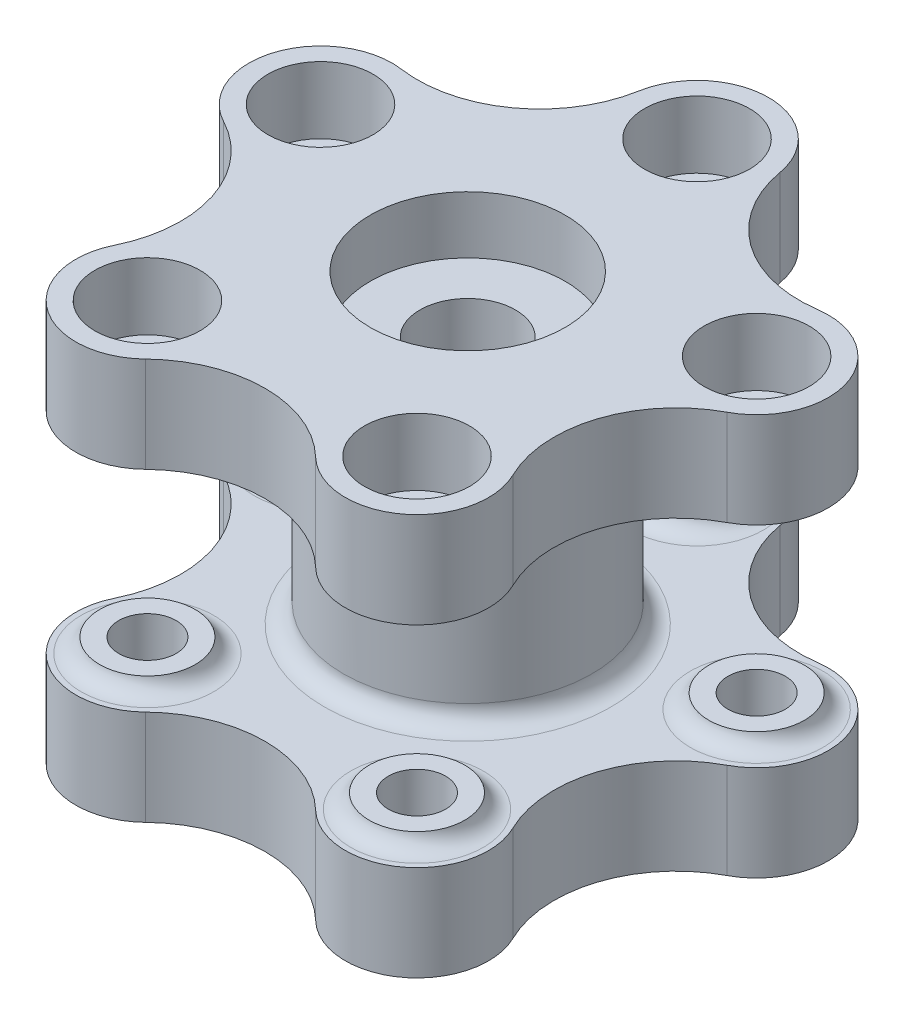
from build123d import *

# Parameters (mm, degrees)
SKETCH1_R           = 1.5
BOSS_EXTRUDE1_DEPTH = 5
SKETCH2_R           = 6.5
BOSS_EXTRUDE2_DEPTH = 11
SKETCH3_R           = 1.5
BOSS_EXTRUDE3_DEPTH = 5
SKETCH4_R           = 1.4
CUT_EXTRUDE1_DEPTH  = 31.314506594
FILLET1_R           = 1
CUT_EXTRUDE2_DEPTH  = 3
SKETCH8_R           = 2.5
SKETCH8_R_2         = 1.5
BOSS_EXTRUDE5_DEPTH = 0.75
FILLET4_R           = 1
BOSS_EXTRUDE6_START = 0.75
SKETCH9_R           = 2.5
SKETCH9_R_2         = 1.5
BOSS_EXTRUDE6_DEPTH = 0.75
FILLET5_R           = 1
SKETCH12_R          = 2.75
CUT_EXTRUDE5_DEPTH  = 3.5
SKETCH10_R          = 5.1
CUT_EXTRUDE3_DEPTH  = 3
CUT_EXTRUDE4_START  = -3.5
SKETCH11_R          = 5.1
CUT_EXTRUDE4_DEPTH  = 3.5


with BuildPart() as part:
    # Sketch1 → Boss-Extrude1 (new body)
    with BuildSketch(Plane(origin=(0, 0, 0), x_dir=(1, 0, 0), z_dir=(0, 1, 0))):
        with BuildLine():
            ThreePointArc((-10.887667616, 7.421270575), (-6.233461404, 8.579623579), (-3.693573417, 12.648085961))
            ThreePointArc((-3.693573417, 12.648085961), (0, 15.75), (3.693573417, 12.648085961))
            ThreePointArc((3.693573417, 12.648085961), (6.233461404, 8.579623579), (10.887667616, 7.421270575))
            ThreePointArc((10.887667616, 7.421270575), (14.979140132, 4.867017661), (13.170421528, 0.395676441))
            ThreePointArc((13.170421528, 0.395676441), (10.08595242, -3.277124596), (10.422522062, -8.061488506))
            ThreePointArc((10.422522062, -8.061488506), (9.257617724, -12.742017661), (4.446194733, -12.403544471))
            ThreePointArc((4.446194733, -12.403544471), (0, -10.604997965), (-4.446194733, -12.403544471))
            ThreePointArc((-4.446194733, -12.403544471), (-9.257617724, -12.742017661), (-10.422522062, -8.061488506))
            ThreePointArc((-10.422522062, -8.061488506), (-10.08595242, -3.277124596), (-13.170421528, 0.395676441))
            ThreePointArc((-13.170421528, 0.395676441), (-14.889028798, 2.301972625), (-14.979140132, 4.867017661))
            ThreePointArc((-14.979140132, 4.867017661), (-13.398542888, 6.889216574), (-10.887667616, 7.421270575))
        make_face()
        with Locations(Location((0, 12, 0), (0, 0, 270))):
            Circle(SKETCH1_R, mode=Mode.SUBTRACT)
        with Locations(Location((11.412678196, 3.708203932, 0), (0, 0, 270))):
            Circle(SKETCH1_R, mode=Mode.SUBTRACT)
        with Locations(Location((7.053423028, -9.708203932, 0), (0, 0, 270))):
            Circle(SKETCH1_R, mode=Mode.SUBTRACT)
        with Locations(Location((-7.053423028, -9.708203932, 0), (0, 0, 270))):
            Circle(SKETCH1_R, mode=Mode.SUBTRACT)
        with Locations(Location((-11.412678196, 3.708203932, 0), (0, 0, 270))):
            Circle(SKETCH1_R, mode=Mode.SUBTRACT)
        with BuildLine():
            Line((-1.430908802, -2.05), (1.430908802, -2.05))
            ThreePointArc((1.430908802, -2.05), (0, 2.5), (-1.430908802, -2.05))
        make_face(mode=Mode.SUBTRACT)
    extrude(amount=BOSS_EXTRUDE1_DEPTH)

    # Sketch2 → Boss-Extrude2 (add)
    with BuildSketch(Plane(origin=(0, 5, 0), x_dir=(1, 0, 0), z_dir=(0, 1, 0))):
        with Locations(Location((0, 0, 0), (0, 0, 270))):
            Circle(SKETCH2_R)
        with BuildLine():
            Line((-1.430908802, -2.05), (1.430908802, -2.05))
            ThreePointArc((1.430908802, -2.05), (0, 2.5), (-1.430908802, -2.05))
        make_face(mode=Mode.SUBTRACT)
    extrude(amount=BOSS_EXTRUDE2_DEPTH)

    # Sketch3 → Boss-Extrude3 (add)
    with BuildSketch(Plane(origin=(0, 16, 0), x_dir=(1, 0, 0), z_dir=(0, 1, 0))):
        with BuildLine():
            ThreePointArc((3.693573417, 12.648085961), (0, 15.75), (-3.693573417, 12.648085961))
            ThreePointArc((-3.693573417, 12.648085961), (-6.233461404, 8.579623579), (-10.887667616, 7.421270575))
            ThreePointArc((-10.887667616, 7.421270575), (-14.979140132, 4.867017661), (-13.170421528, 0.395676441))
            ThreePointArc((-13.170421528, 0.395676441), (-10.08595242, -3.277124596), (-10.422522062, -8.061488506))
            ThreePointArc((-10.422522062, -8.061488506), (-9.257617724, -12.742017661), (-4.446194733, -12.403544471))
            ThreePointArc((-4.446194733, -12.403544471), (0, -10.604997965), (4.446194733, -12.403544471))
            ThreePointArc((4.446194733, -12.403544471), (9.257617724, -12.742017661), (10.422522062, -8.061488506))
            ThreePointArc((10.422522062, -8.061488506), (10.08595242, -3.277124596), (13.170421528, 0.395676441))
            ThreePointArc((13.170421528, 0.395676441), (14.979140132, 4.867017661), (10.887667616, 7.421270575))
            ThreePointArc((10.887667616, 7.421270575), (6.233461404, 8.579623579), (3.693573417, 12.648085961))
        make_face()
        with Locations(Location((-7.053423028, -9.708203932, 0), (0, 0, 270))):
            Circle(SKETCH3_R, mode=Mode.SUBTRACT)
        with Locations(Location((7.053423028, -9.708203932, 0), (0, 0, 270))):
            Circle(SKETCH3_R, mode=Mode.SUBTRACT)
        with Locations(Location((11.412678196, 3.708203932, 0), (0, 0, 270))):
            Circle(SKETCH3_R, mode=Mode.SUBTRACT)
        with Locations(Location((-11.412678196, 3.708203932, 0), (0, 0, 270))):
            Circle(SKETCH3_R, mode=Mode.SUBTRACT)
        with Locations(Location((0, 12, 0), (0, 0, 270))):
            Circle(SKETCH3_R, mode=Mode.SUBTRACT)
        with BuildLine():
            Line((-1.430908802, -2.05), (1.430908802, -2.05))
            ThreePointArc((1.430908802, -2.05), (0, 2.5), (-1.430908802, -2.05))
        make_face(mode=Mode.SUBTRACT)
    extrude(amount=BOSS_EXTRUDE3_DEPTH)

    # Sketch4 → Cut-Extrude1 (cut, through all)
    with BuildSketch(Plane.XY):
        with Locations(Location((0, 10.5, 0), (0, 0, 180))):
            Circle(SKETCH4_R)
    extrude(amount=CUT_EXTRUDE1_DEPTH, mode=Mode.SUBTRACT)

    # Fillet1
    fillet1_edges = [part.edges().sort_by_distance(p)[0] for p in [
        (0, 16, -6.5),
        (0, 5, -6.5),
    ]]
    fillet(fillet1_edges, radius=FILLET1_R)

    # Sketch6 → Cut-Extrude2 (cut)
    with BuildSketch(Plane.XZ):
        Polygon((-12.072886484, -6.814239726), (-9.052876438, -5.832978979), (-8.392668149, -2.726943186), (-10.752469907, -0.602168139), (-13.772479953, -1.583428886), (-14.432688242, -4.689464679), align=None)
        Polygon((2.75, -13.58771324), (2.75, -10.41228676), (0, -8.824573519), (-2.75, -10.41228676), (-2.75, -13.58771324), (0, -15.175426481), align=None)
        Polygon((-10.21145419, 9.376281482), (-8.344985335, 6.807307495), (-5.186954173, 7.139229945), (-3.895391865, 10.040126383), (-5.76186072, 12.60910037), (-8.919891883, 12.27717792), align=None)
        Polygon((5.76186072, 12.60910037), (3.895391865, 10.040126383), (5.186954173, 7.139229945), (8.344985335, 6.807307495), (10.21145419, 9.376281482), (8.919891883, 12.27717792), align=None)
        Polygon((13.772479953, -1.583428886), (10.752469907, -0.602168139), (8.392668149, -2.726943186), (9.052876438, -5.832978979), (12.072886484, -6.814239726), (14.432688242, -4.689464679), align=None)
    extrude(amount=-CUT_EXTRUDE2_DEPTH, mode=Mode.SUBTRACT)

    # Sketch8 → Boss-Extrude5 (add)
    # profile 1 of 5: a face of its own
    with BuildSketch(Plane(origin=(0, 5, 0), x_dir=(1, 0, 0), z_dir=(0, 1, 0))):
        with Locations(Location((-7.053423028, -9.708203932, 0), (0, 0, 270))):
            Circle(SKETCH8_R)
        with Locations(Location((-7.053423028, -9.708203932, 0), (0, 0, 90))):
            Circle(SKETCH8_R_2, mode=Mode.SUBTRACT)
    # profile 2 of 5: a face of its own
    with BuildSketch(Plane(origin=(0, 5, 0), x_dir=(1, 0, 0), z_dir=(0, 1, 0))):
        with Locations(Location((-11.412678196, 3.708203932, 0), (0, 0, 270))):
            Circle(SKETCH8_R)
        with Locations(Location((-11.412678196, 3.708203932, 0), (0, 0, 90))):
            Circle(SKETCH8_R_2, mode=Mode.SUBTRACT)
    # profile 3 of 5: a face of its own
    with BuildSketch(Plane(origin=(0, 5, 0), x_dir=(1, 0, 0), z_dir=(0, 1, 0))):
        with Locations(Location((0, 12, 0), (0, 0, 270))):
            Circle(SKETCH8_R)
        with Locations(Location((0, 12, 0), (0, 0, 90))):
            Circle(SKETCH8_R_2, mode=Mode.SUBTRACT)
    # profile 4 of 5: a face of its own
    with BuildSketch(Plane(origin=(0, 5, 0), x_dir=(1, 0, 0), z_dir=(0, 1, 0))):
        with Locations(Location((11.412678196, 3.708203932, 0), (0, 0, 270))):
            Circle(SKETCH8_R)
        with Locations(Location((11.412678196, 3.708203932, 0), (0, 0, 90))):
            Circle(SKETCH8_R_2, mode=Mode.SUBTRACT)
    # profile 5 of 5: a face of its own
    with BuildSketch(Plane(origin=(0, 5, 0), x_dir=(1, 0, 0), z_dir=(0, 1, 0))):
        with Locations(Location((7.053423028, -9.708203932, 0), (0, 0, 270))):
            Circle(SKETCH8_R)
        with Locations(Location((7.053423028, -9.708203932, 0), (0, 0, 90))):
            Circle(SKETCH8_R_2, mode=Mode.SUBTRACT)
    extrude(amount=BOSS_EXTRUDE5_DEPTH)

    # Fillet4
    # the kernel refuses this fillet: 1 mm, written as the material it adds along each edge
    with BuildSketch(Plane(origin=(-7.053423028, 5, 9.708203932), x_dir=(0, 0, 1), z_dir=(-1, 0, 0))) as fillet4_piece_1:
        with BuildLine():
            CenterArc((3.468245837, 1), FILLET4_R, 194.477512186, 75.522487814)
            Line((2.5, 0.75), (2.480635083, 0.745))
            ThreePointArc((2.480635083, 0.745), (2.48, 0.375), (2.48, 0))
            Line((2.48, 0), (2.5, -0.02))
            Line((2.5, -0.02), (3.468245837, -0.02))
            Line((3.468245837, -0.02), (3.468245837, 0))
        make_face()
    revolve(axis=Axis((-7.053423028, 5, 9.708203932), (0, 1, 0)))
    with BuildSketch(Plane(origin=(-11.412678196, 5, -3.708203932), x_dir=(0, 0, 1), z_dir=(-1, 0, 0))) as fillet4_piece_2:
        with BuildLine():
            CenterArc((3.468245837, 1), FILLET4_R, 194.477512186, 75.522487814)
            Line((2.5, 0.75), (2.480635083, 0.745))
            ThreePointArc((2.480635083, 0.745), (2.48, 0.375), (2.48, 0))
            Line((2.48, 0), (2.5, -0.02))
            Line((2.5, -0.02), (3.468245837, -0.02))
            Line((3.468245837, -0.02), (3.468245837, 0))
        make_face()
    revolve(axis=Axis((-11.412678196, 5, -3.708203932), (0, 1, 0)))
    with BuildSketch(Plane(origin=(0, 5, -12), x_dir=(0, 0, 1), z_dir=(-1, 0, 0))) as fillet4_piece_3:
        with BuildLine():
            CenterArc((3.468245837, 1), FILLET4_R, 194.477512186, 75.522487814)
            Line((2.5, 0.75), (2.480635083, 0.745))
            ThreePointArc((2.480635083, 0.745), (2.48, 0.375), (2.48, 0))
            Line((2.48, 0), (2.5, -0.02))
            Line((2.5, -0.02), (3.468245837, -0.02))
            Line((3.468245837, -0.02), (3.468245837, 0))
        make_face()
    revolve(axis=Axis((0, 5, -12), (0, 1, 0)))
    with BuildSketch(Plane(origin=(11.412678196, 5, -3.708203932), x_dir=(0, 0, 1), z_dir=(-1, 0, 0))) as fillet4_piece_4:
        with BuildLine():
            CenterArc((3.468245837, 1), FILLET4_R, 194.477512186, 75.522487814)
            Line((2.5, 0.75), (2.480635083, 0.745))
            ThreePointArc((2.480635083, 0.745), (2.48, 0.375), (2.48, 0))
            Line((2.48, 0), (2.5, -0.02))
            Line((2.5, -0.02), (3.468245837, -0.02))
            Line((3.468245837, -0.02), (3.468245837, 0))
        make_face()
    revolve(axis=Axis((11.412678196, 5, -3.708203932), (0, 1, 0)))
    with BuildSketch(Plane(origin=(7.053423028, 5, 9.708203932), x_dir=(0, 0, 1), z_dir=(-1, 0, 0))) as fillet4_piece_5:
        with BuildLine():
            CenterArc((3.468245837, 1), FILLET4_R, 194.477512186, 75.522487814)
            Line((2.5, 0.75), (2.480635083, 0.745))
            ThreePointArc((2.480635083, 0.745), (2.48, 0.375), (2.48, 0))
            Line((2.48, 0), (2.5, -0.02))
            Line((2.5, -0.02), (3.468245837, -0.02))
            Line((3.468245837, -0.02), (3.468245837, 0))
        make_face()
    revolve(axis=Axis((7.053423028, 5, 9.708203932), (0, 1, 0)))

    # Sketch9 → Boss-Extrude6 (add)
    # profile 1 of 5: a face of its own
    with BuildSketch(Plane.XZ.offset(-16).offset(BOSS_EXTRUDE6_START)):
        with Locations(Location((0, -12, 0), (0, 0, 90))):
            Circle(SKETCH9_R)
        with Locations(Location((0, -12, 0), (0, 0, 270))):
            Circle(SKETCH9_R_2, mode=Mode.SUBTRACT)
    # profile 2 of 5: a face of its own
    with BuildSketch(Plane.XZ.offset(-16).offset(BOSS_EXTRUDE6_START)):
        with Locations(Location((-11.412678196, -3.708203932, 0), (0, 0, 90))):
            Circle(SKETCH9_R)
        with Locations(Location((-11.412678196, -3.708203932, 0), (0, 0, 270))):
            Circle(SKETCH9_R_2, mode=Mode.SUBTRACT)
    # profile 3 of 5: a face of its own
    with BuildSketch(Plane.XZ.offset(-16).offset(BOSS_EXTRUDE6_START)):
        with Locations(Location((-7.053423028, 9.708203932, 0), (0, 0, 90))):
            Circle(SKETCH9_R)
        with Locations(Location((-7.053423028, 9.708203932, 0), (0, 0, 270))):
            Circle(SKETCH9_R_2, mode=Mode.SUBTRACT)
    # profile 4 of 5: a face of its own
    with BuildSketch(Plane.XZ.offset(-16).offset(BOSS_EXTRUDE6_START)):
        with Locations(Location((7.053423028, 9.708203932, 0), (0, 0, 90))):
            Circle(SKETCH9_R)
        with Locations(Location((7.053423028, 9.708203932, 0), (0, 0, 270))):
            Circle(SKETCH9_R_2, mode=Mode.SUBTRACT)
    # profile 5 of 5: a face of its own
    with BuildSketch(Plane.XZ.offset(-16).offset(BOSS_EXTRUDE6_START)):
        with Locations(Location((11.412678196, -3.708203932, 0), (0, 0, 90))):
            Circle(SKETCH9_R)
        with Locations(Location((11.412678196, -3.708203932, 0), (0, 0, 270))):
            Circle(SKETCH9_R_2, mode=Mode.SUBTRACT)
    extrude(amount=-BOSS_EXTRUDE6_DEPTH)

    # Fillet5
    # the kernel refuses this fillet: 1 mm, written as the material it adds along each edge
    with BuildSketch(Plane(origin=(0, 16, -12), x_dir=(0, 0, 1), z_dir=(1, 0, 0))) as fillet5_piece_1:
        with BuildLine():
            CenterArc((3.468245837, 1), FILLET5_R, 194.477512186, 75.522487814)
            Line((2.5, 0.75), (2.480635083, 0.745))
            ThreePointArc((2.480635083, 0.745), (2.48, 0.375), (2.48, 0))
            Line((2.48, 0), (2.5, -0.02))
            Line((2.5, -0.02), (3.468245837, -0.02))
            Line((3.468245837, -0.02), (3.468245837, 0))
        make_face()
    revolve(axis=Axis((0, 16, -12), (0, -1, 0)))
    with BuildSketch(Plane(origin=(-11.412678196, 16, -3.708203932), x_dir=(0, 0, 1), z_dir=(1, 0, 0))) as fillet5_piece_2:
        with BuildLine():
            CenterArc((3.468245837, 1), FILLET5_R, 194.477512186, 75.522487814)
            Line((2.5, 0.75), (2.480635083, 0.745))
            ThreePointArc((2.480635083, 0.745), (2.48, 0.375), (2.48, 0))
            Line((2.48, 0), (2.5, -0.02))
            Line((2.5, -0.02), (3.468245837, -0.02))
            Line((3.468245837, -0.02), (3.468245837, 0))
        make_face()
    revolve(axis=Axis((-11.412678196, 16, -3.708203932), (0, -1, 0)))
    with BuildSketch(Plane(origin=(-7.053423028, 16, 9.708203932), x_dir=(0, 0, 1), z_dir=(1, 0, 0))) as fillet5_piece_3:
        with BuildLine():
            CenterArc((3.468245837, 1), FILLET5_R, 194.477512186, 75.522487814)
            Line((2.5, 0.75), (2.480635083, 0.745))
            ThreePointArc((2.480635083, 0.745), (2.48, 0.375), (2.48, 0))
            Line((2.48, 0), (2.5, -0.02))
            Line((2.5, -0.02), (3.468245837, -0.02))
            Line((3.468245837, -0.02), (3.468245837, 0))
        make_face()
    revolve(axis=Axis((-7.053423028, 16, 9.708203932), (0, -1, 0)))
    with BuildSketch(Plane(origin=(7.053423028, 16, 9.708203932), x_dir=(0, 0, 1), z_dir=(1, 0, 0))) as fillet5_piece_4:
        with BuildLine():
            CenterArc((3.468245837, 1), FILLET5_R, 194.477512186, 75.522487814)
            Line((2.5, 0.75), (2.480635083, 0.745))
            ThreePointArc((2.480635083, 0.745), (2.48, 0.375), (2.48, 0))
            Line((2.48, 0), (2.5, -0.02))
            Line((2.5, -0.02), (3.468245837, -0.02))
            Line((3.468245837, -0.02), (3.468245837, 0))
        make_face()
    revolve(axis=Axis((7.053423028, 16, 9.708203932), (0, -1, 0)))
    with BuildSketch(Plane(origin=(11.412678196, 16, -3.708203932), x_dir=(0, 0, 1), z_dir=(1, 0, 0))) as fillet5_piece_5:
        with BuildLine():
            CenterArc((3.468245837, 1), FILLET5_R, 194.477512186, 75.522487814)
            Line((2.5, 0.75), (2.480635083, 0.745))
            ThreePointArc((2.480635083, 0.745), (2.48, 0.375), (2.48, 0))
            Line((2.48, 0), (2.5, -0.02))
            Line((2.5, -0.02), (3.468245837, -0.02))
            Line((3.468245837, -0.02), (3.468245837, 0))
        make_face()
    revolve(axis=Axis((11.412678196, 16, -3.708203932), (0, -1, 0)))

    # Sketch12 → Cut-Extrude5 (cut)
    with BuildSketch(Plane(origin=(0, 21, 0), x_dir=(1, 0, 0), z_dir=(0, 1, 0))):
        with Locations(Location((0, 12, 0), (0, 0, 270))):
            Circle(SKETCH12_R)
        with Locations(Location((11.412678196, 3.708203932, 0), (0, 0, 270))):
            Circle(SKETCH12_R)
        with Locations(Location((7.053423028, -9.708203932, 0), (0, 0, 270))):
            Circle(SKETCH12_R)
        with Locations(Location((-7.053423028, -9.708203932, 0), (0, 0, 270))):
            Circle(SKETCH12_R)
        with Locations(Location((-11.412678196, 3.708203932, 0), (0, 0, 270))):
            Circle(SKETCH12_R)
    extrude(amount=-CUT_EXTRUDE5_DEPTH, mode=Mode.SUBTRACT)

    # Sketch10 → Cut-Extrude3 (cut)
    with BuildSketch(Plane(origin=(0, 21, 0), x_dir=(1, 0, 0), z_dir=(0, 1, 0))):
        with Locations(Location((0, 0, 0), (0, 0, 270))):
            Circle(SKETCH10_R)
    extrude(amount=-CUT_EXTRUDE3_DEPTH, mode=Mode.SUBTRACT)

    # Sketch11 → Cut-Extrude4 (cut)
    with BuildSketch(Plane.XZ.offset(CUT_EXTRUDE4_START)):
        with Locations(Location((0, 0, 0), (0, 0, 90))):
            Circle(SKETCH11_R)
    extrude(amount=CUT_EXTRUDE4_DEPTH, mode=Mode.SUBTRACT)


solid = part.part
